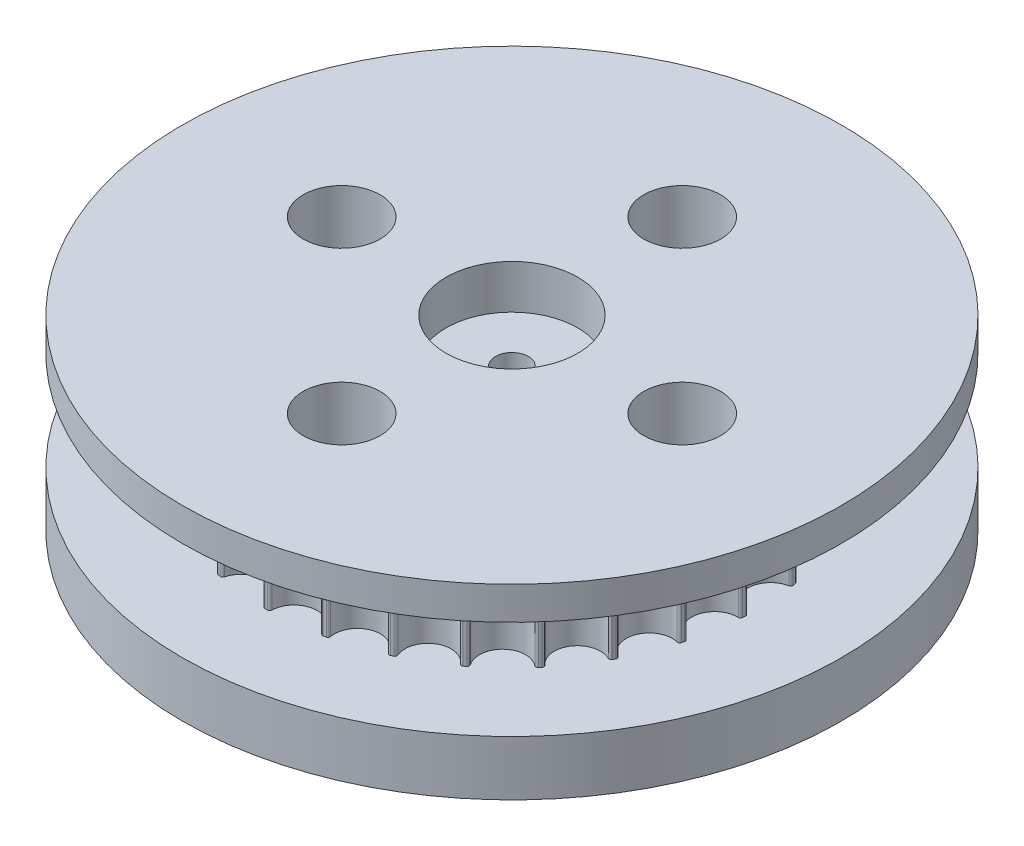
from build123d import *

# Parameters (mm, degrees)
SKETCH1_R           = 30
SKETCH1_R_2         = 1.5
BOSS_EXTRUDE1_DEPTH = 5
SKETCH2_R           = 1.5
BOSS_EXTRUDE2_DEPTH = 9
SKETCH3_R           = 30
SKETCH3_R_2         = 1.5
BOSS_EXTRUDE3_DEPTH = 3
SKETCH4_R           = 6
CUT_EXTRUDE1_DEPTH  = 4
SKETCH5_R           = 1.5
CUT_EXTRUDE2_DEPTH  = 45.09081537
SKETCH6_R           = 3.5
CUT_EXTRUDE3_DEPTH  = 5


with BuildPart() as part:
    # Sketch1 → Boss-Extrude1 (new body)
    with BuildSketch(Plane(origin=(0, 0, 0), x_dir=(1, 0, 0), z_dir=(0, 1, 0))):
        Circle(SKETCH1_R)
        with Locations((0, 15.5)):
            Circle(SKETCH1_R_2, mode=Mode.SUBTRACT)
        with Locations((15.5, 0)):
            Circle(SKETCH1_R_2, mode=Mode.SUBTRACT)
        with Locations((0, -15.5)):
            Circle(SKETCH1_R_2, mode=Mode.SUBTRACT)
        with Locations((-15.5, 0)):
            Circle(SKETCH1_R_2, mode=Mode.SUBTRACT)
        Circle(SKETCH1_R_2, mode=Mode.SUBTRACT)
    extrude(amount=BOSS_EXTRUDE1_DEPTH)

    # Sketch2 → Boss-Extrude2 (add)
    with BuildSketch(Plane(origin=(0, 5, 0), x_dir=(1, 0, 0), z_dir=(0, 1, 0))):
        with BuildLine():
            Line((2.298551641, 22.254277442), (2.539199037, 22.228105461))
            ThreePointArc((2.539199037, 22.228105461), (2.670825131, 22.156613046), (2.715887922, 22.013763689))
            ThreePointArc((2.715887922, 22.013763689), (4.358024031, 19.798702775), (6.778466337, 21.119522558))
            ThreePointArc((6.778466337, 21.119522558), (6.879345106, 21.230247749), (7.028824599, 21.239864144))
            Line((7.028824599, 21.239864144), (7.258219591, 21.162571972))
            ThreePointArc((7.258219591, 21.162571972), (7.371399584, 21.064455292), (7.384700443, 20.915258505))
            ThreePointArc((7.384700443, 20.915258505), (8.512271702, 18.398973762), (11.160062622, 19.168589965))
            ThreePointArc((11.160062622, 19.168589965), (11.282385545, 19.255040508), (11.430437531, 19.232298406))
            Line((11.430437531, 19.232298406), (11.637853863, 19.107500139))
            ThreePointArc((11.637853863, 19.107500139), (11.727295585, 18.987347019), (11.708212578, 18.838779079))
            ThreePointArc((11.708212578, 18.838779079), (12.268495009, 16.138929185), (15.019826783, 16.321355409))
            ThreePointArc((15.019826783, 16.321355409), (15.157874175, 16.379488974), (15.297575908, 16.325451769))
            Line((15.297575908, 16.325451769), (15.473315023, 16.158982836))
            ThreePointArc((15.473315023, 16.158982836), (15.534836278, 16.022411503), (15.484261706, 15.881419281))
            ThreePointArc((15.484261706, 15.881419281), (15.451057125, 13.124246216), (18.177280536, 12.710952414))
            ThreePointArc((18.177280536, 12.710952414), (18.324597455, 12.73805074), (18.449416638, 12.655245151))
            Line((18.449416638, 12.655245151), (18.585261171, 12.454889455))
            ThreePointArc((18.585261171, 12.454889455), (18.615985293, 12.308285833), (18.536283966, 12.181461969))
            ThreePointArc((18.536283966, 12.181461969), (17.911144982, 9.495888081), (20.484784855, 8.506199412))
            ThreePointArc((20.484784855, 8.506199412), (20.634482925, 8.500995411), (20.738583151, 8.393293336))
            Line((20.738583151, 8.393293336), (20.828181161, 8.168419286))
            ThreePointArc((20.828181161, 8.168419286), (20.826671525, 8.018638396), (20.72157019, 7.911913033))
            ThreePointArc((20.72157019, 7.911913033), (19.533727607, 5.423512773), (21.834443401, 3.903705978))
            ThreePointArc((21.834443401, 3.903705978), (21.979522907, 3.866442984), (22.058036564, 3.738880453))
            Line((22.058036564, 3.738880453), (22.09719855, 3.500002909))
            ThreePointArc((22.09719855, 3.500002909), (22.063525745, 3.354048341), (21.937938822, 3.272411838))
            ThreePointArc((21.937938822, 3.272411838), (20.242934839, 1.097540036), (22.16314764, -0.881320408))
            ThreePointArc((22.16314764, -0.881320408), (22.296824826, -0.948900019), (22.346080704, -1.090358325))
            Line((22.346080704, -1.090358325), (22.332975494, -1.332069714))
            ThreePointArc((22.332975494, -1.332069714), (22.268714022, -1.467373288), (22.128513816, -1.520103698))
            ThreePointArc((22.128513816, -1.520103698), (20.005604936, -3.279752454), (21.455527729, -5.625137231))
            ThreePointArc((21.455527729, -5.625137231), (21.571551997, -5.719873512), (21.589246946, -5.868613159))
            Line((21.589246946, -5.868613159), (21.524487324, -6.101856237))
            ThreePointArc((21.524487324, -6.101856237), (21.432641981, -6.220182172), (21.284384099, -6.241540875))
            ThreePointArc((21.284384099, -6.241540875), (18.832835181, -7.503687364), (19.744671187, -10.105928889))
            ThreePointArc((19.744671187, -10.105928889), (19.837617372, -10.223392077), (19.822923996, -10.372458165))
            Line((19.822923996, -10.372458165), (19.709538051, -10.586326745))
            ThreePointArc((19.709538051, -10.586326745), (19.594403423, -10.682142251), (19.445020237, -10.671130537))
            ThreePointArc((19.445020237, -10.671130537), (16.779462985, -11.376758193), (17.110575765, -14.114178544))
            ThreePointArc((17.110575765, -14.114178544), (17.176097807, -14.24887619), (17.129703151, -14.391298554))
            Line((17.129703151, -14.391298554), (16.972992683, -14.575792379))
            ThreePointArc((16.972992683, -14.575792379), (16.839952337, -14.644617231), (16.696428841, -14.601749996))
            ThreePointArc((16.696428841, -14.601749996), (13.941501748, -14.717864453), (13.676408837, -17.462464898))
            ThreePointArc((13.676408837, -17.462464898), (13.711442998, -17.60809869), (13.635516425, -17.737217819))
            Line((13.635516425, -17.737217819), (13.442809042, -17.883710162))
            ThreePointArc((13.442809042, -17.883710162), (13.298083797, -17.922326185), (13.167130989, -17.849607853))
            ThreePointArc((13.167130989, -17.849607853), (10.451651384, -17.370779728), (9.602748232, -19.994225801))
            ThreePointArc((9.602748232, -19.994225801), (9.605656353, -20.143986065), (9.503748106, -20.253764491))
            Line((9.503748106, -20.253764491), (9.284054591, -20.355405534))
            ThreePointArc((9.284054591, -20.355405534), (9.134411638, -20.362007086), (9.022152725, -20.262837886))
            ThreePointArc((9.022152725, -20.262837886), (6.473093418, -19.21145665), (5.080073793, -21.591078927))
            ThreePointArc((5.080073793, -21.591078927), (5.050719894, -21.73796304), (4.927595088, -21.823267646))
            Line((4.927595088, -21.823267646), (4.691188066, -21.875304767))
            ThreePointArc((4.691188066, -21.875304767), (4.543624543, -21.849583167), (4.455308628, -21.728600139))
            ThreePointArc((4.455308628, -21.728600139), (2.191860797, -20.153827211), (0.319860749, -22.1783572))
            ThreePointArc((0.319860749, -22.1783572), (0.259617386, -22.315497023), (0.1210332, -22.372339061))
            Line((0.1210332, -22.372339061), (-0.1210332, -22.372339061))
            ThreePointArc((-0.1210332, -22.372339061), (-0.259617386, -22.315497023), (-0.319860749, -22.1783572))
            ThreePointArc((-0.319860749, -22.1783572), (-2.191860797, -20.153827211), (-4.455308628, -21.728600139))
            ThreePointArc((-4.455308628, -21.728600139), (-4.543624543, -21.849583167), (-4.691188066, -21.875304767))
            Line((-4.691188066, -21.875304767), (-4.927595088, -21.823267646))
            ThreePointArc((-4.927595088, -21.823267646), (-5.050719894, -21.73796304), (-5.080073793, -21.591078927))
            ThreePointArc((-5.080073793, -21.591078927), (-6.473093418, -19.21145665), (-9.022152725, -20.262837886))
            ThreePointArc((-9.022152725, -20.262837886), (-9.134411638, -20.362007086), (-9.284054591, -20.355405534))
            Line((-9.284054591, -20.355405534), (-9.503748106, -20.253764491))
            ThreePointArc((-9.503748106, -20.253764491), (-9.605656353, -20.143986065), (-9.602748232, -19.994225801))
            ThreePointArc((-9.602748232, -19.994225801), (-10.451651384, -17.370779728), (-13.167130989, -17.849607853))
            ThreePointArc((-13.167130989, -17.849607853), (-13.298083797, -17.922326185), (-13.442809042, -17.883710162))
            Line((-13.442809042, -17.883710162), (-13.635516425, -17.737217819))
            ThreePointArc((-13.635516425, -17.737217819), (-13.711442998, -17.60809869), (-13.676408837, -17.462464898))
            ThreePointArc((-13.676408837, -17.462464898), (-13.941501748, -14.717864453), (-16.696428841, -14.601749996))
            ThreePointArc((-16.696428841, -14.601749996), (-16.839952337, -14.644617231), (-16.972992683, -14.575792379))
            Line((-16.972992683, -14.575792379), (-17.129703151, -14.391298554))
            ThreePointArc((-17.129703151, -14.391298554), (-17.176097807, -14.24887619), (-17.110575765, -14.114178544))
            ThreePointArc((-17.110575765, -14.114178544), (-16.779462985, -11.376758193), (-19.445020237, -10.671130537))
            ThreePointArc((-19.445020237, -10.671130537), (-19.594403423, -10.682142251), (-19.709538051, -10.586326745))
            Line((-19.709538051, -10.586326745), (-19.822923996, -10.372458165))
            ThreePointArc((-19.822923996, -10.372458165), (-19.837617372, -10.223392077), (-19.744671187, -10.105928889))
            ThreePointArc((-19.744671187, -10.105928889), (-18.832835181, -7.503687364), (-21.284384099, -6.241540875))
            ThreePointArc((-21.284384099, -6.241540875), (-21.432641981, -6.220182172), (-21.524487324, -6.101856237))
            Line((-21.524487324, -6.101856237), (-21.589246946, -5.868613159))
            ThreePointArc((-21.589246946, -5.868613159), (-21.571551997, -5.719873512), (-21.455527729, -5.625137231))
            ThreePointArc((-21.455527729, -5.625137231), (-20.005604936, -3.279752454), (-22.128513816, -1.520103698))
            ThreePointArc((-22.128513816, -1.520103698), (-22.268714022, -1.467373288), (-22.332975494, -1.332069714))
            Line((-22.332975494, -1.332069714), (-22.346080704, -1.090358325))
            ThreePointArc((-22.346080704, -1.090358325), (-22.296824826, -0.948900019), (-22.16314764, -0.881320408))
            ThreePointArc((-22.16314764, -0.881320408), (-20.242934839, 1.097540036), (-21.937938822, 3.272411838))
            ThreePointArc((-21.937938822, 3.272411838), (-22.063525745, 3.354048341), (-22.09719855, 3.500002909))
            Line((-22.09719855, 3.500002909), (-22.058036564, 3.738880453))
            ThreePointArc((-22.058036564, 3.738880453), (-21.979522907, 3.866442984), (-21.834443401, 3.903705978))
            ThreePointArc((-21.834443401, 3.903705978), (-19.533727607, 5.423512773), (-20.72157019, 7.911913033))
            ThreePointArc((-20.72157019, 7.911913033), (-20.826671525, 8.018638396), (-20.828181161, 8.168419286))
            Line((-20.828181161, 8.168419286), (-20.738583151, 8.393293336))
            ThreePointArc((-20.738583151, 8.393293336), (-20.634482925, 8.500995411), (-20.484784855, 8.506199412))
            ThreePointArc((-20.484784855, 8.506199412), (-17.911144982, 9.495888081), (-18.536283966, 12.181461969))
            ThreePointArc((-18.536283966, 12.181461969), (-18.615985293, 12.308285833), (-18.585261171, 12.454889455))
            Line((-18.585261171, 12.454889455), (-18.449416638, 12.655245151))
            ThreePointArc((-18.449416638, 12.655245151), (-18.324597455, 12.73805074), (-18.177280536, 12.710952414))
            ThreePointArc((-18.177280536, 12.710952414), (-15.451057125, 13.124246216), (-15.484261706, 15.881419281))
            ThreePointArc((-15.484261706, 15.881419281), (-15.534836278, 16.022411503), (-15.473315023, 16.158982836))
            Line((-15.473315023, 16.158982836), (-15.297575908, 16.325451769))
            ThreePointArc((-15.297575908, 16.325451769), (-15.157874175, 16.379488974), (-15.019826783, 16.321355409))
            ThreePointArc((-15.019826783, 16.321355409), (-12.268495009, 16.138929185), (-11.708212578, 18.838779079))
            ThreePointArc((-11.708212578, 18.838779079), (-11.727295585, 18.987347019), (-11.637853863, 19.107500139))
            Line((-11.637853863, 19.107500139), (-11.430437531, 19.232298406))
            ThreePointArc((-11.430437531, 19.232298406), (-11.282385545, 19.255040508), (-11.160062622, 19.168589965))
            ThreePointArc((-11.160062622, 19.168589965), (-8.512271702, 18.398973762), (-7.384700443, 20.915258505))
            ThreePointArc((-7.384700443, 20.915258505), (-7.371399584, 21.064455292), (-7.258219591, 21.162571972))
            Line((-7.258219591, 21.162571972), (-7.028824599, 21.239864144))
            ThreePointArc((-7.028824599, 21.239864144), (-6.879345106, 21.230247749), (-6.778466337, 21.119522558))
            ThreePointArc((-6.778466337, 21.119522558), (-4.358024031, 19.798702775), (-2.715887922, 22.013763689))
            ThreePointArc((-2.715887922, 22.013763689), (-2.670825131, 22.156613046), (-2.539199037, 22.228105461))
            Line((-2.539199037, 22.228105461), (-2.298551641, 22.254277442))
            ThreePointArc((-2.298551641, 22.254277442), (-2.154634136, 22.2127522), (-2.079916499, 22.08292975))
            ThreePointArc((-2.079916499, 22.08292975), (0, 20.272666451), (2.079916499, 22.08292975))
            ThreePointArc((2.079916499, 22.08292975), (2.154634136, 22.2127522), (2.298551641, 22.254277442))
        make_face()
        with Locations((0, 15.5)):
            Circle(SKETCH2_R, mode=Mode.SUBTRACT)
        with Locations((15.5, 0)):
            Circle(SKETCH2_R, mode=Mode.SUBTRACT)
        with Locations((0, -15.5)):
            Circle(SKETCH2_R, mode=Mode.SUBTRACT)
        with Locations((-15.5, 0)):
            Circle(SKETCH2_R, mode=Mode.SUBTRACT)
    extrude(amount=BOSS_EXTRUDE2_DEPTH)

    # Sketch3 → Boss-Extrude3 (add)
    with BuildSketch(Plane(origin=(0, 14, 0), x_dir=(1, 0, 0), z_dir=(0, 1, 0))):
        Circle(SKETCH3_R)
        with Locations((0, 15.5)):
            Circle(SKETCH3_R_2, mode=Mode.SUBTRACT)
        with Locations((15.5, 0)):
            Circle(SKETCH3_R_2, mode=Mode.SUBTRACT)
        with Locations((0, -15.5)):
            Circle(SKETCH3_R_2, mode=Mode.SUBTRACT)
        with Locations((-15.5, 0)):
            Circle(SKETCH3_R_2, mode=Mode.SUBTRACT)
    extrude(amount=BOSS_EXTRUDE3_DEPTH)

    # Sketch4 → Cut-Extrude1 (cut)
    with BuildSketch(Plane(origin=(0, 17, 0), x_dir=(1, 0, 0), z_dir=(0, 1, 0))):
        Circle(SKETCH4_R)
    extrude(amount=-CUT_EXTRUDE1_DEPTH, mode=Mode.SUBTRACT)

    # Sketch5 → Cut-Extrude2 (cut, through all)
    with BuildSketch(Plane.XZ.offset(-5)):
        Circle(SKETCH5_R)
    extrude(amount=-CUT_EXTRUDE2_DEPTH, mode=Mode.SUBTRACT)

    # Sketch6 → Cut-Extrude3 (cut)
    with BuildSketch(Plane(origin=(0, 17, 0), x_dir=(1, 0, 0), z_dir=(0, 1, 0))):
        with Locations((15.5, 0)):
            Circle(SKETCH6_R)
        with Locations((0, -15.5)):
            Circle(SKETCH6_R)
        with Locations((-15.5, 0)):
            Circle(SKETCH6_R)
        with Locations((0, 15.5)):
            Circle(SKETCH6_R)
    extrude(amount=-CUT_EXTRUDE3_DEPTH, mode=Mode.SUBTRACT)


solid = part.part
